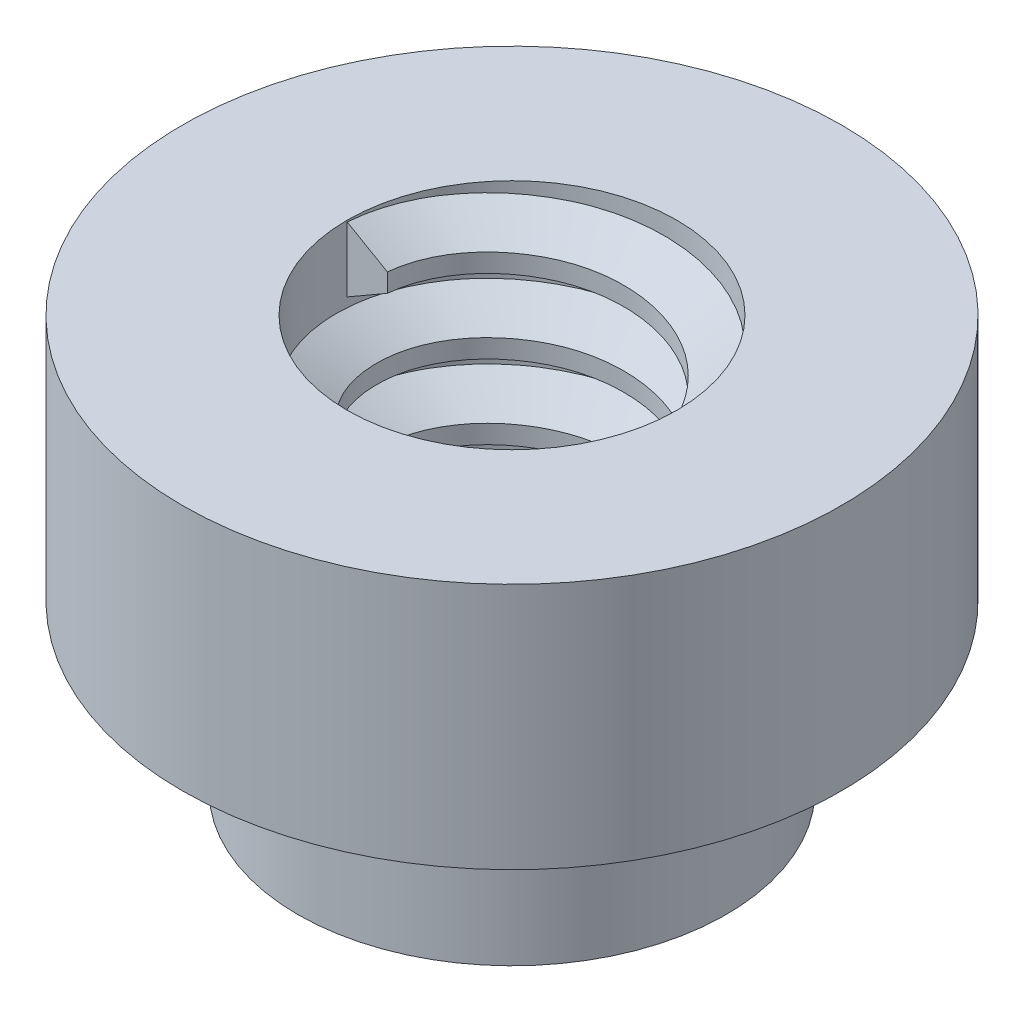
from build123d import *

# Parameters (mm, degrees)
BASES_R       = 2
BASES_R_2     = 1
BASE_DEPTH    = 1.25
THREAD1_PITCH = 0.45
SKETCH1_W     = 0.7
SKETCH1_H     = 1


with BuildPart() as part:
    # BaseS → Base (new, symmetric)
    with BuildSketch(Plane(origin=(0, 0, 0), x_dir=(1, 0, 0), z_dir=(0, 1, 0))):
        with Locations(Location((0, 0, 0), (0, 0, 270))):
            Circle(BASES_R)
        with Locations(Location((0, 0, 0), (0, 0, 270))):
            Circle(BASES_R_2, mode=Mode.SUBTRACT)
    extrude(amount=BASE_DEPTH, both=True)

    # Thread1: the profile of Thread Profile1 profile screwed along a right-hand helix of 4.644444 turns, 6 arcs to a turn; built about Z, then put on its axis
    thread1_z = Axis((0, 0, 0), (0, 0, 1))
    thread1_corners = [(1.0003, 0, -0.000173205), (1.0003, 0, 0.393923204), (0.756430356, 0, 0.253124999), (0.756430356, 0, 0.140624999)]
    with BuildLine(mode=Mode.PRIVATE) as thread1_profile:
        Line(thread1_corners[0], thread1_corners[1])
        Line(thread1_corners[1], thread1_corners[2])
        Line(thread1_corners[2], thread1_corners[3])
        Line(thread1_corners[3], thread1_corners[0])
    thread1_cap = Face(thread1_profile.wire())
    thread1_turn_angles = [0, 30, 60, 90, 120, 150, 180, 210, 240, 270, 300, 330, 360]
    thread1_turn_weights = [1, 0.8660254037844387, 1, 0.8660254037844387, 1, 0.8660254037844387, 1, 0.8660254037844387, 1, 0.8660254037844387, 1, 0.8660254037844387, 1]
    thread1_turn_rails = [Edge.make_bspline([Vector(p[0], p[1], 0).rotate(thread1_z, thread1_turn_angles[k]) / thread1_turn_weights[k] + Vector(0, 0, p[2] + THREAD1_PITCH * thread1_turn_angles[k] / 360) for k in range(13)], [0, 0, 0, 1, 1, 2, 2, 3, 3, 4, 4, 5, 5, 6, 6, 6], 2, thread1_turn_weights) for p in thread1_corners]
    thread1_turn_sides = [Face.make_surface_from_curves(thread1_turn_rails[p[0]], thread1_turn_rails[p[1]]) for p in [(0, 1), (1, 2), (2, 3), (3, 0)]]
    thread1_last_angles = [1440, 1470, 1500, 1530, 1560, 1590, 1620, 1646, 1672]
    thread1_last_weights = [1, 0.8660254037844387, 1, 0.8660254037844387, 1, 0.8660254037844387, 1, 0.8987940462991653, 1]
    thread1_last_rails = [Edge.make_bspline([Vector(p[0], p[1], 0).rotate(thread1_z, thread1_last_angles[k]) / thread1_last_weights[k] + Vector(0, 0, p[2] + THREAD1_PITCH * thread1_last_angles[k] / 360) for k in range(9)], [0, 0, 0, 1, 1, 2, 2, 3, 3, 4, 4, 4], 2, thread1_last_weights) for p in thread1_corners]
    thread1_last_sides = [Face.make_surface_from_curves(thread1_last_rails[p[0]], thread1_last_rails[p[1]]) for p in [(0, 1), (1, 2), (2, 3), (3, 0)]]
    thread1 = Plane(origin=(0, 1.24, 0), x_dir=(-1, 0, 0), z_dir=(0, -1, 0)) * Solid(Shell([*[p.moved(Location((0, 0, THREAD1_PITCH * i))) for i in range(4) for p in thread1_turn_sides], *thread1_last_sides, thread1_cap, thread1_cap.rotate(thread1_z, 1672).moved(Location((0, 0, THREAD1_PITCH * 1672 / 360)))]))
    add(thread1)

    # Sketch1 → Cut-Revolve1 (revolve, cut)
    with BuildSketch(Plane.XY, mode=Mode.PRIVATE) as cut_revolve1_sk:
        with Locations((1.65, -0.75)):
            Rectangle(SKETCH1_W, SKETCH1_H)
    revolve(cut_revolve1_sk.sketch.rotate(Axis((0, 1.424121105, 0), (0, -1, 0)), 90), axis=Axis((0, 1.424121105, 0), (0, -1, 0)), mode=Mode.SUBTRACT)


solid = part.part
